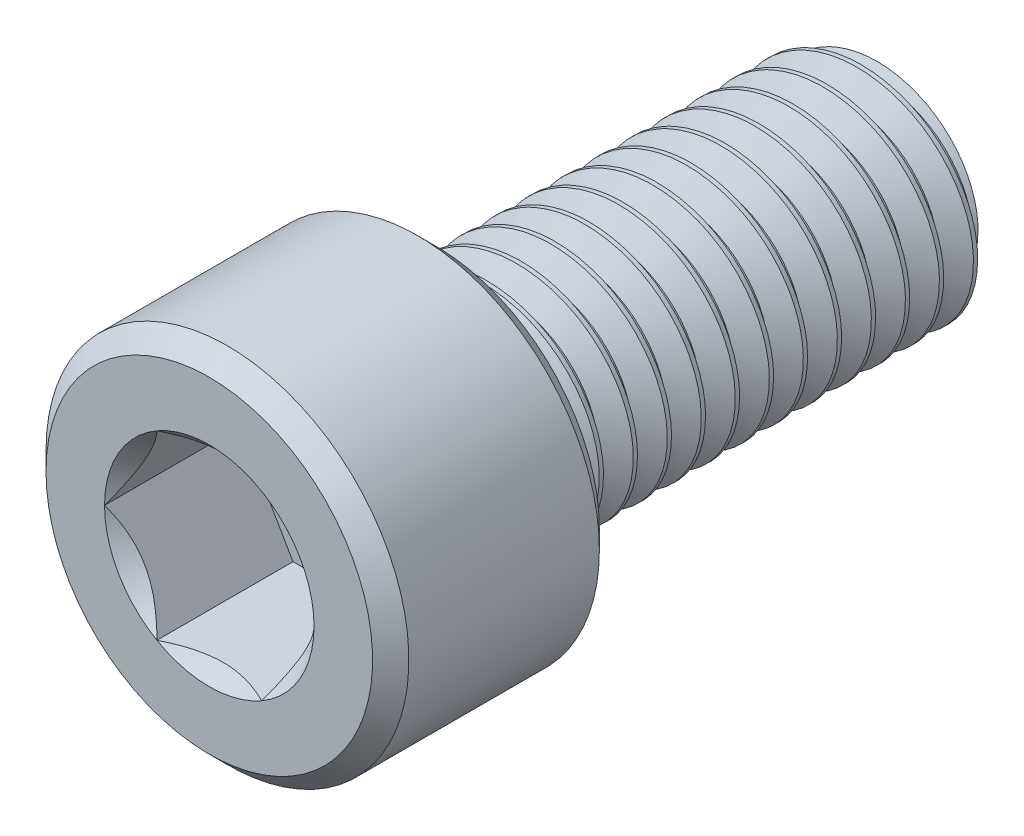
from build123d import *

# Parameters (mm, degrees)
SKETCH1_R           = 5
BOSS_EXTRUDE1_DEPTH = 20
CUT_SWEEP1_PITCH    = 1.5
SKETCH5_R           = 8
BOSS_EXTRUDE2_DEPTH = 10
CUT_EXTRUDE1_DEPTH  = 6
CHAMFER1_SIZE       = 0.8


with BuildPart() as part:
    # Sketch1 → Boss-Extrude1 (new body)
    with BuildSketch(Plane.XY):
        Circle(SKETCH1_R)
    extrude(amount=BOSS_EXTRUDE1_DEPTH)

    # Cut-Sweep1: the profile of Sketch3 screwed along a right-hand helix of 30 turns, 8 arcs to a turn; built about Z, then put on its axis
    cut_sweep1_z = Axis((0, 0, 0), (0, 0, 1))
    cut_sweep1_corners = [(5, 0, 0), (5, 0.062572103, -1.310507051), (4.026587446, 0.035769114, -0.749146561), (4.026587446, 0.026802989, -0.56136049)]
    with BuildLine(mode=Mode.PRIVATE) as cut_sweep1_profile:
        Line(cut_sweep1_corners[0], cut_sweep1_corners[1])
        Line(cut_sweep1_corners[1], cut_sweep1_corners[2])
        Line(cut_sweep1_corners[2], cut_sweep1_corners[3])
        Line(cut_sweep1_corners[3], cut_sweep1_corners[0])
    cut_sweep1_cap = Face(cut_sweep1_profile.wire())
    cut_sweep1_turn_angles = [0, 22.5, 45, 67.5, 90, 112.5, 135, 157.5, 180, 202.5, 225, 247.5, 270, 292.5, 315, 337.5, 360]
    cut_sweep1_turn_weights = [1, 0.9238795325112867, 1, 0.9238795325112867, 1, 0.9238795325112867, 1, 0.9238795325112867, 1, 0.9238795325112867, 1, 0.9238795325112867, 1, 0.9238795325112867, 1, 0.9238795325112867, 1]
    cut_sweep1_turn_rails = [Edge.make_bspline([Vector(p[0], p[1], 0).rotate(cut_sweep1_z, cut_sweep1_turn_angles[k]) / cut_sweep1_turn_weights[k] + Vector(0, 0, p[2] + CUT_SWEEP1_PITCH * cut_sweep1_turn_angles[k] / 360) for k in range(17)], [0, 0, 0, 1, 1, 2, 2, 3, 3, 4, 4, 5, 5, 6, 6, 7, 7, 8, 8, 8], 2, cut_sweep1_turn_weights) for p in cut_sweep1_corners]
    cut_sweep1_turn_sides = [Face.make_surface_from_curves(cut_sweep1_turn_rails[p[0]], cut_sweep1_turn_rails[p[1]]) for p in [(0, 1), (1, 2), (2, 3), (3, 0)]]
    cut_sweep1 = Plane(origin=(0, 0, 0), x_dir=(0, 1, 0), z_dir=(0, 0, 1)) * Solid(Shell([*[p.moved(Location((0, 0, CUT_SWEEP1_PITCH * i))) for i in range(30) for p in cut_sweep1_turn_sides], cut_sweep1_cap, cut_sweep1_cap.rotate(cut_sweep1_z, 10800).moved(Location((0, 0, CUT_SWEEP1_PITCH * 10800 / 360)))]))
    add(cut_sweep1, mode=Mode.SUBTRACT)

    # Sketch4 → Cut-Revolve1 (revolve, cut)
    with BuildSketch(Plane(origin=(0, 0, 0), x_dir=(0, 0, -1), z_dir=(1, 0, 0)), mode=Mode.PRIVATE) as cut_revolve1_sk:
        Polygon((0, 6), (-1.559651061, 6), (0, 3.772587446), align=None)
    revolve(cut_revolve1_sk.sketch.rotate(Axis((0, 0, 0), (0, 0, -1)), 90), axis=Axis((0, 0, 0), (0, 0, -1)), mode=Mode.SUBTRACT)

    # Sketch5 → Boss-Extrude2 (add)
    with BuildSketch(Plane.XY.offset(20)):
        Circle(SKETCH5_R)
    extrude(amount=BOSS_EXTRUDE2_DEPTH)

    # Sketch6 → Cut-Extrude1 (cut)
    with BuildSketch(Plane.XY.offset(30)):
        Polygon((2.309401077, 4), (-2.309401077, 4), (-4.618802154, 0), (-2.309401077, -4), (2.309401077, -4), (4.618802154, 0), align=None)
    extrude(amount=-CUT_EXTRUDE1_DEPTH, mode=Mode.SUBTRACT)

    # Cut-Extrude2 cone 1 section (through the dimple's axis) → Cut-Extrude2 (revolve, cut)
    with BuildSketch(Plane(origin=(0, 0, 30), x_dir=(0, -1, 0), z_dir=(1, 0, 0))):
        Polygon((0, 0), (4.618802154, 0), (0, 4.618802154), align=None)
    revolve(axis=Axis((0, 0, 30), (0, 0, -1)), mode=Mode.SUBTRACT)

    # Chamfer1
    chamfer1_edges = [part.edges().sort_by_distance(p)[0] for p in [
        (-8, 0, 20),
        (-8, 0, 30),
    ]]
    chamfer(chamfer1_edges, length=CHAMFER1_SIZE)


solid = part.part
